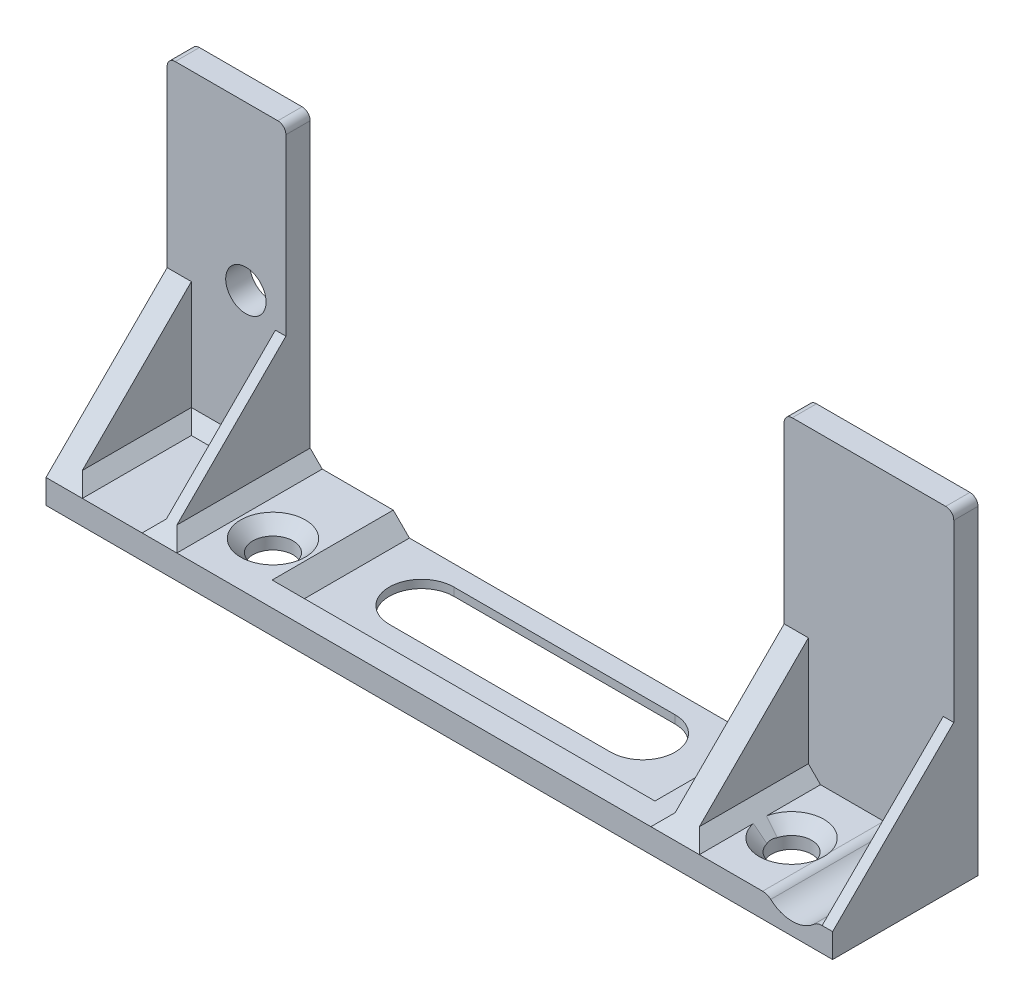
from build123d import *

# Parameters (mm, degrees)
ESBO_O2_R                = 2.5
ESBO_O2_R_2              = 2
RESSALTO_EXTRUS_O1_DEPTH = 3
ESBO_O3_W                = 5.4
ESBO_O3_H                = 7.4
ESBO_O3_W_2              = 3.4
ESBO_O3_H_2              = 5.4
RESSALTO_EXTRUS_O2_DEPTH = 1.2
RESSALTO_EXTRUS_O3_DEPTH = 15
CHANFRO1_SIZE            = 2
FILETE1_R                = 1.5
FILETE2_R                = 1
RESSALTO_EXTRUS_O4_DEPTH = 3
RESSALTO_EXTRUS_O5_DEPTH = 1.3
RESSALTO_EXTRUS_O6_DEPTH = 1.3
RESSALTO_EXTRUS_O7_DEPTH = 3
CHANFRO2_SIZE            = 1.5
ESBO_O10_R               = 2.5
CORTE_EXTRUS_O1_DEPTH    = 13
CHANFRO3_SIZE            = 1.5
CORTE_EXTRUS_O2_DEPTH    = 13
ESBO_O12_W               = 47.4
ESBO_O12_H               = 3
RESSALTO_EXTRUS_O8_DEPTH = 3
CHANFRO4_SIZE            = 2


# Some blends are built 0.0001 mm under size
with BuildPart() as part:
    # Esboço2 → Ressalto-extrusão1 (new body)
    with BuildSketch(Plane.XY):
        with BuildLine():
            Line((-19.293876913, 20.175), (-19.293876913, -17.425))
            Line((-19.293876913, -17.425), (-9, -17.425))
            Line((-9, -17.425), (-9, -19.425))
            Line((-9, -19.425), (38.4, -19.425))
            Line((38.4, -19.425), (38.4, -17.425))
            Line((38.4, -17.425), (42.4, -17.425))
            Line((42.4, -17.425), (42.4, 20.175))
            Line((42.4, 20.175), (62.4, 20.175))
            ThreePointArc((62.4, 20.175), (63.107106781, 19.882106781), (63.4, 19.175))
            Line((63.4, 19.175), (63.4, -20.425))
            Line((63.4, -20.425), (42.4, -20.425))
            Line((42.4, -20.425), (-19.293876913, -20.425))
            Line((-19.293876913, -20.425), (-34, -20.425))
            Line((-34, -20.425), (-34, 19.175))
            ThreePointArc((-34, 19.175), (-33.707106781, 19.882106781), (-33, 20.175))
            Line((-33, 20.175), (-19.293876913, 20.175))
        make_face()
        with Locations((-24.25, 0)):
            Circle(ESBO_O2_R, mode=Mode.SUBTRACT)
        with Locations((58.4, -14.825)):
            Circle(ESBO_O2_R_2, mode=Mode.SUBTRACT)
    extrude(amount=RESSALTO_EXTRUS_O1_DEPTH)

    # Esboço3 → Ressalto-extrusão2 (add)
    with BuildSketch(Plane(origin=(0, 0, 0), x_dir=(-1, 0, 0), z_dir=(0, 0, -1))):
        with Locations((-48.4, 11.175)):
            Rectangle(ESBO_O3_W, ESBO_O3_H)
        with Locations((-48.4, -10.825)):
            Rectangle(ESBO_O3_W, ESBO_O3_H)
        with Locations((27, 11.175)):
            Rectangle(ESBO_O3_W_2, ESBO_O3_H_2)
        with Locations((27, -10.825)):
            Rectangle(ESBO_O3_W_2, ESBO_O3_H_2)
    extrude(amount=RESSALTO_EXTRUS_O2_DEPTH)

    # Esboço4 → Ressalto-extrusão3 (add)
    with BuildSketch(Plane.XY.offset(3)):
        with BuildLine():
            Line((-34, -20.425), (63.4, -20.425))
            Line((63.4, -20.425), (63.4, -17.425))
            Line((63.4, -17.425), (61.439736831, -17.425))
            ThreePointArc((61.439736831, -17.425), (58.4, -18.825), (55.360263169, -17.425))
            Line((55.360263169, -17.425), (38.4, -17.425))
            Line((38.4, -17.425), (38.4, -19.425))
            Line((38.4, -19.425), (-9, -19.425))
            Line((-9, -19.425), (-9, -17.425))
            Line((-9, -17.425), (-34, -17.425))
            Line((-34, -17.425), (-34, -20.425))
        make_face()
    extrude(amount=RESSALTO_EXTRUS_O3_DEPTH)

    # Chanfro1
    chanfro1_edges = [part.edges().sort_by_distance(p)[0] for p in [
        (38.4, -19.425, 9),
        (-9, -19.425, 9),
    ]]
    chamfer(chanfro1_edges, length=CHANFRO1_SIZE - 0.0001)  # a hair under: the kernel refuses the full size

    # Filete1
    filete1_edges = [part.edges().sort_by_distance(p)[0] for p in [
        (61.439736831, -17.425, 10.5),
        (55.360263169, -17.425, 10.5),
    ]]
    fillet(filete1_edges, radius=FILETE1_R)

    # Filete2
    filete2_edges = [part.edges().sort_by_distance(p)[0] for p in [
        (-19.293876913, 20.175, 1.5),
        (42.4, 20.175, 1.5),
    ]]
    fillet(filete2_edges, radius=FILETE2_R)

    # Esboço6 → Ressalto-extrusão4 (add)
    with BuildSketch(Plane.ZY.offset(34)):
        Polygon((18, -17.425), (3, -2.425), (3, -17.425), align=None)
    extrude(amount=-RESSALTO_EXTRUS_O4_DEPTH)

    # Esboço7 → Ressalto-extrusão5 (add)
    with BuildSketch(Plane(origin=(63.4, 0, 0), x_dir=(0, 0, -1), z_dir=(1, 0, 0))):
        Polygon((-18, -17.425), (-3, -2.5), (-3, -17.425), align=None)
    extrude(amount=-RESSALTO_EXTRUS_O5_DEPTH)

    # Esboço8 → Ressalto-extrusão6 (add)
    with BuildSketch(Plane(origin=(-19.293876913, 0, 0), x_dir=(0, 0, -1), z_dir=(1, 0, 0))):
        Polygon((-3, -2.425), (-3, -17.425), (-18, -17.425), align=None)
    extrude(amount=-RESSALTO_EXTRUS_O6_DEPTH)

    # Esboço9 → Ressalto-extrusão7 (add)
    with BuildSketch(Plane.ZY.offset(-42.4)):
        Polygon((3, -2.425), (3, -17.425), (18, -17.425), align=None)
    extrude(amount=-RESSALTO_EXTRUS_O7_DEPTH)

    # Chanfro2
    chanfro2_edges = [part.edges().sort_by_distance(p)[0] for p in [
        (-31, -17.425, 10.5),
        (-25.796938457, -17.425, 3),
        (-20.593876913, -17.425, 10.5),
        (45.4, -17.425, 10.5),
        (-19.293876913, -17.425, 9),
        (42.4, -17.425, 9),
    ]]
    chamfer(chanfro2_edges, length=CHANFRO2_SIZE)

    # Esboço10 → Corte-extrusão1 (cut)
    with BuildSketch(Plane(origin=(0, -17.425, 0), x_dir=(1, 0, 0), z_dir=(0, 1, 0))):
        with Locations(Location((-13.396938457, -10.5, 0), (0, 0, 270))):
            Circle(ESBO_O10_R)
        with Locations(Location((50.816969722, -10.5, 0), (0, 0, 270))):
            Circle(ESBO_O10_R)
    extrude(amount=-CORTE_EXTRUS_O1_DEPTH, mode=Mode.SUBTRACT)

    # Chanfro3
    # the kernel refuses this chamfer: 1.5 mm, written as the material it takes off along each edge
    with BuildSketch(Plane(origin=(-13.396938457, -17.425, 10.5), x_dir=(0, 0, 1), z_dir=(-1, 0, 0))) as chanfro3_piece_1:
        Polygon((2.5 + CHANFRO3_SIZE, 0), (2.5, -CHANFRO3_SIZE), (2.5, 0), align=None)
    revolve(axis=Axis((-13.396938457, -17.425, 10.5), (0, 1, 0)), mode=Mode.SUBTRACT)
    with BuildSketch(Plane(origin=(50.816969722, -17.425, 10.5), x_dir=(0, 0, 1), z_dir=(-1, 0, 0))) as chanfro3_piece_2_section:
        Polygon((2.5 + CHANFRO3_SIZE, 0), (2.5, -CHANFRO3_SIZE), (2.5, 0), align=None)
    chanfro3_piece_2 = revolve(axis=Axis((50.816969722, -17.425, 10.5), (0, 1, 0)), mode=Mode.PRIVATE)
    chanfro3_piece_2 = split(chanfro3_piece_2, bisect_by=Plane(origin=(50.475171982, -21.000171982, 8.459359331), z_dir=(0.7071067811865476, 0.7071067811865476, 0)), keep=Keep.TOP, mode=Mode.PRIVATE)
    add(chanfro3_piece_2, mode=Mode.SUBTRACT)

    # Esboço11 → Corte-extrusão2 (cut)
    with BuildSketch(Plane(origin=(0, -19.425, 0), x_dir=(1, 0, 0), z_dir=(0, 1, 0))):
        with BuildLine():
            Line((1, -2.5), (28.4, -2.5))
            ThreePointArc((28.4, -2.5), (32.4, -6.5), (28.4, -10.5))
            Line((28.4, -10.5), (1, -10.5))
            ThreePointArc((1, -10.5), (-3, -6.5), (1, -2.5))
        make_face()
    extrude(amount=-CORTE_EXTRUS_O2_DEPTH, mode=Mode.SUBTRACT)

    # Esboço12 → Ressalto-extrusão8 (add)
    with BuildSketch(Plane.XY.offset(18)):
        with Locations((14.7, -18.925)):
            Rectangle(ESBO_O12_W, ESBO_O12_H)
    extrude(amount=-RESSALTO_EXTRUS_O8_DEPTH)

    # Chanfro4
    chanfro4_edges = [part.edges().sort_by_distance(p)[0] for p in [
        (14.7, -19.425, 15),
    ]]
    chamfer(chanfro4_edges, length=CHANFRO4_SIZE - 0.0001)  # a hair under: the kernel refuses the full size


solid = part.part
